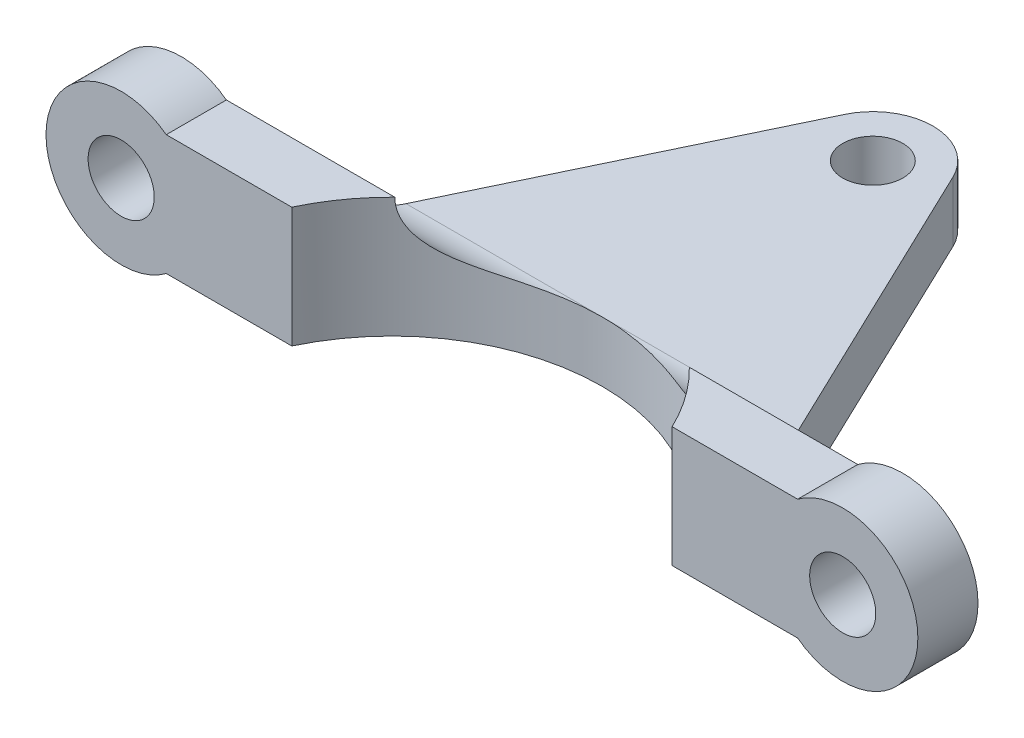
from build123d import *

# Parameters (mm, degrees)
SKETCH1_R           = 2
SKETCH1_R_2         = 1
BOSS_EXTRUDE1_DEPTH = 4
SKETCH2_R           = 1.1
CUT_EXTRUDE1_DEPTH  = 2
SKETCH3_W           = 14.966629548
SKETCH3_H           = 2
CUT_EXTRUDE2_DEPTH  = 23
FILLET1_R           = 3
FILLET2_R           = 2
FILLET3_R           = 2
SKETCH4_R           = 2.5
SKETCH4_R_2         = 1.1
BOSS_EXTRUDE2_DEPTH = 2


with BuildPart() as part:
    # Sketch1 → Boss-Extrude1 (new body)
    # profile 1 of 9: a face of its own
    with BuildSketch(Plane(origin=(0, 0, 0), x_dir=(1, 0, 0), z_dir=(0, 1, 0))):
        with BuildLine():
            Line((-14, 3), (-8.485281374, 3))
            ThreePointArc((-8.485281374, 3), (-8.04667731, 4.031250956), (-7.483314774, 5))
            Line((-7.483314774, 5), (-14, 5))
            Line((-14, 5), (-14, 3))
        make_face()
    # profile 2 of 9: a face of its own
    with BuildSketch(Plane(origin=(0, 0, 0), x_dir=(1, 0, 0), z_dir=(0, 1, 0))):
        with BuildLine():
            ThreePointArc((-7.483314774, 5), (-8.04667731, 4.031250956), (-8.485281374, 3))
            Line((-8.485281374, 3), (-6.32455532, 3))
            ThreePointArc((-6.32455532, 3), (-5.700169593, 4.063012013), (-4.898979486, 5))
            Line((-4.898979486, 5), (-7.483314774, 5))
        make_face()
    # profile 3 of 9: a face of its own
    with BuildSketch(Plane(origin=(0, 0, 0), x_dir=(1, 0, 0), z_dir=(0, 1, 0))):
        with BuildLine():
            ThreePointArc((4.898979486, 5), (5.700169593, 4.063012013), (6.32455532, 3))
            Line((6.32455532, 3), (8.485281374, 3))
            ThreePointArc((8.485281374, 3), (8.04667731, 4.031250956), (7.483314774, 5))
            Line((7.483314774, 5), (4.898979486, 5))
        make_face()
    # profile 4 of 9: a face of its own
    with BuildSketch(Plane(origin=(0, 0, 0), x_dir=(1, 0, 0), z_dir=(0, 1, 0))):
        with BuildLine():
            ThreePointArc((7.483314774, 5), (0, 9), (-7.483314774, 5))
            Line((-7.483314774, 5), (-4.898979486, 5))
            ThreePointArc((-4.898979486, 5), (0, 7), (4.898979486, 5))
            Line((4.898979486, 5), (7.483314774, 5))
        make_face()
    # profile 5 of 9: a face of its own
    with BuildSketch(Plane(origin=(0, 0, 0), x_dir=(1, 0, 0), z_dir=(0, 1, 0))):
        with BuildLine():
            Line((-1.803943959, 16.863589134), (-7.483314774, 5))
            ThreePointArc((-7.483314774, 5), (0, 9), (7.483314774, 5))
            Line((7.483314774, 5), (1.803943959, 16.863589134))
            ThreePointArc((1.803943959, 16.863589134), (1.950370211, 16.44278216), (2, 16))
            ThreePointArc((2, 16), (-0.44278216, 14.049629789), (-1.803943959, 16.863589134))
        make_face()
    # profile 6 of 9: a face of its own
    with BuildSketch(Plane(origin=(0, 0, 0), x_dir=(1, 0, 0), z_dir=(0, 1, 0))):
        with BuildLine():
            Line((14, 5), (7.483314774, 5))
            ThreePointArc((7.483314774, 5), (8.04667731, 4.031250956), (8.485281374, 3))
            Line((8.485281374, 3), (14, 3))
            Line((14, 3), (14, 5))
        make_face()
    # profile 7 of 9: a face of its own
    with BuildSketch(Plane(origin=(0, 0, 0), x_dir=(1, 0, 0), z_dir=(0, 1, 0))):
        with BuildLine():
            ThreePointArc((-7.483314774, 5), (-8.04667731, 4.031250956), (-8.485281374, 3))
            Line((-8.485281374, 3), (-6.32455532, 3))
            ThreePointArc((-6.32455532, 3), (-5.700169593, 4.063012013), (-4.898979486, 5))
            Line((-4.898979486, 5), (-7.483314774, 5))
        make_face()
    # profile 8 of 9: a face of its own
    with BuildSketch(Plane(origin=(0, 0, 0), x_dir=(1, 0, 0), z_dir=(0, 1, 0))):
        with BuildLine():
            ThreePointArc((4.898979486, 5), (5.700169593, 4.063012013), (6.32455532, 3))
            Line((6.32455532, 3), (8.485281374, 3))
            ThreePointArc((8.485281374, 3), (8.04667731, 4.031250956), (7.483314774, 5))
            Line((7.483314774, 5), (4.898979486, 5))
        make_face()
    # profile 9 of 9: a face of its own
    with BuildSketch(Plane(origin=(0, 0, 0), x_dir=(1, 0, 0), z_dir=(0, 1, 0))):
        with Locations((0, 16)):
            Circle(SKETCH1_R)
        with Locations(Location((0, 16, 0), (0, 0, 270))):
            Circle(SKETCH1_R_2, mode=Mode.SUBTRACT)
    extrude(amount=BOSS_EXTRUDE1_DEPTH)

    # Sketch2 → Cut-Extrude1 (cut)
    with BuildSketch(Plane(origin=(0, 0, -5), x_dir=(-1, 0, 0), z_dir=(0, 0, -1))):
        with Locations((-12, 2)):
            Circle(SKETCH2_R)
        with Locations((12, 2)):
            Circle(SKETCH2_R)
    extrude(amount=-CUT_EXTRUDE1_DEPTH, mode=Mode.SUBTRACT)

    # Sketch3 → Cut-Extrude2 (cut)
    with BuildSketch(Plane(origin=(0, 0, -5), x_dir=(-1, 0, 0), z_dir=(0, 0, -1))):
        with Locations((0, 3)):
            Rectangle(SKETCH3_W, SKETCH3_H)
    extrude(amount=CUT_EXTRUDE2_DEPTH, mode=Mode.SUBTRACT)

    # Fillet1
    fillet1_edges = [part.edges().sort_by_distance(p)[0] for p in [
        (-7.483314774, 1, -5),
        (7.483314774, 1, -5),
    ]]
    fillet(fillet1_edges, radius=FILLET1_R)

    # Fillet2
    fillet2_edges = [part.edges().sort_by_distance(p)[0] for p in [
        (-14, 0, -4),
        (14, 0, -4),
        (14, 4, -4),
        (-14, 4, -4),
    ]]
    fillet(fillet2_edges, radius=FILLET2_R - 0.0001)  # a hair under: the kernel refuses the full size

    # Fillet3
    fillet3_edges = [part.edges().sort_by_distance(p)[0] for p in [
        (7.13608574, 2, -5),
        (-7.13608574, 2, -5),
    ]]
    fillet(fillet3_edges, radius=FILLET3_R - 0.0001)  # a hair under: the kernel refuses the full size

    # Sketch4 → Boss-Extrude2 (add)
    # profile 1 of 2: a face of its own
    with BuildSketch(Plane(origin=(0, 0, -5), x_dir=(-1, 0, 0), z_dir=(0, 0, -1))):
        with Locations((12, 2)):
            Circle(SKETCH4_R)
        with Locations((12, 2)):
            Circle(SKETCH4_R_2, mode=Mode.SUBTRACT)
    # profile 2 of 2: a face of its own
    with BuildSketch(Plane(origin=(0, 0, -5), x_dir=(-1, 0, 0), z_dir=(0, 0, -1))):
        with Locations((-12, 2)):
            Circle(SKETCH4_R)
        with Locations((-12, 2)):
            Circle(SKETCH4_R_2, mode=Mode.SUBTRACT)
    extrude(amount=-BOSS_EXTRUDE2_DEPTH)


solid = part.part
